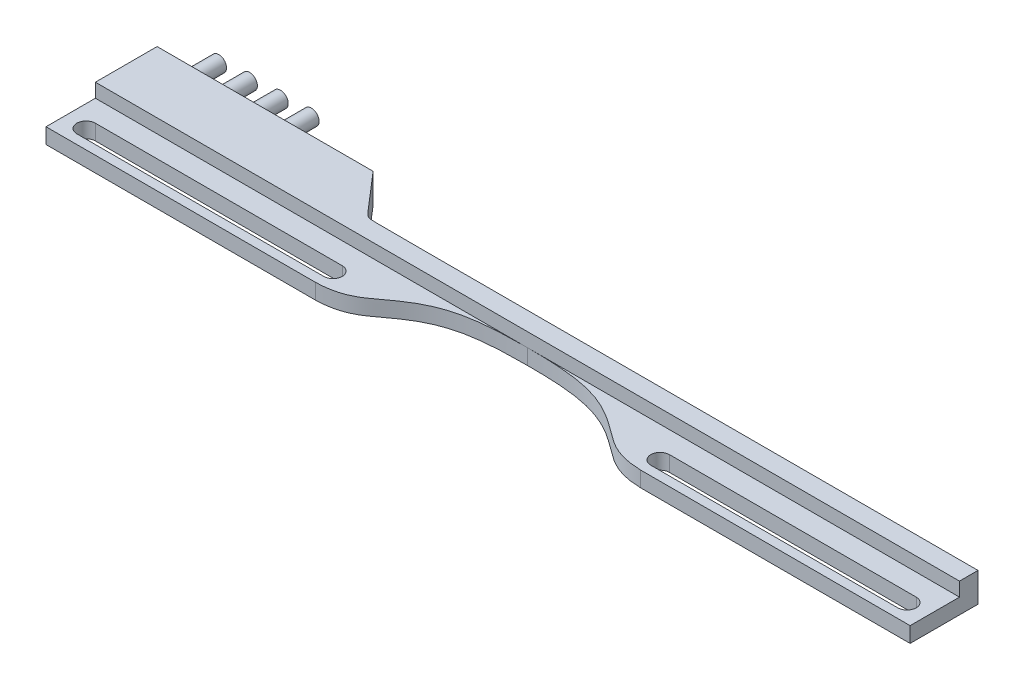
from build123d import *

# Parameters (mm, degrees)
ESBO_O1_W                = 15
ESBO_O1_H                = 4.75
RESSALTO_EXTRUS_O1_DEPTH = 140
ESBO_O3_W                = 105
ESBO_O3_H                = 7
CORTE_EXTRUS_O1_DEPTH    = 30
SKETCH1_W                = 188.959516426
SKETCH1_H                = 16.492662785
CUT_EXTRUDE2_DEPTH       = 10
SKETCH2_W                = 140
SKETCH2_H                = 8
BOSS_EXTRUDE1_DEPTH      = 2.5
CUT_EXTRUDE4_DEPTH       = 2.5
SKETCH6_R                = 1.25
BOSS_EXTRUDE2_DEPTH      = 5
FILLET1_START            = -2.375
FILLET1_DEPTH            = 4.75
CUT_EXTRUDE6_DEPTH       = 10


with BuildPart() as part:
    # Esboço1 → Ressalto-extrusão1 (new body)
    with BuildSketch(Plane(origin=(0, 0, 0), x_dir=(0, 0, -1), z_dir=(1, 0, 0))):
        with Locations((-7.5, 0)):
            Rectangle(ESBO_O1_W, ESBO_O1_H)
    extrude(amount=RESSALTO_EXTRUS_O1_DEPTH)

    # Esboço3 → Corte-extrusão1 (cut)
    with BuildSketch(Plane(origin=(0, 2.375, 0), x_dir=(1, 0, 0), z_dir=(0, 1, 0))):
        with Locations((87.5, -8.5)):
            Rectangle(ESBO_O3_W, ESBO_O3_H)
    extrude(amount=-CORTE_EXTRUS_O1_DEPTH, mode=Mode.SUBTRACT)

    # Sketch1 → Cut-Extrude2 (cut)
    with BuildSketch(Plane(origin=(0, 2.375, 0), x_dir=(1, 0, 0), z_dir=(0, 1, 0))):
        with Locations((94.479758213, 3.246331393)):
            Rectangle(SKETCH1_W, SKETCH1_H)
    extrude(amount=-CUT_EXTRUDE2_DEPTH, mode=Mode.SUBTRACT)

    # Sketch2 → Boss-Extrude1 (add)
    with BuildSketch(Plane.XZ.offset(2.375)):
        with Locations((70, 19)):
            Rectangle(SKETCH2_W, SKETCH2_H)
    extrude(amount=-BOSS_EXTRUDE1_DEPTH)

    # Sketch5 → Cut-Extrude4 (cut)
    with BuildSketch(Plane(origin=(0, 0.125, 0), x_dir=(1, 0, 0), z_dir=(0, 1, 0))):
        with BuildLine():
            Line((3.5, -18.5), (43.5, -18.5))
            ThreePointArc((43.5, -18.5), (45, -20), (43.5, -21.5))
            Line((43.5, -21.5), (3.5, -21.5))
            ThreePointArc((3.5, -21.5), (2, -20), (3.5, -18.5))
        make_face()
        with BuildLine():
            Line((136.5, -18.5), (96.5, -18.5))
            ThreePointArc((96.5, -18.5), (95, -20), (96.5, -21.5))
            Line((96.5, -21.5), (136.5, -21.5))
            ThreePointArc((136.5, -21.5), (138, -20), (136.5, -18.5))
        make_face()
    extrude(amount=-CUT_EXTRUDE4_DEPTH, mode=Mode.SUBTRACT)

    # Sketch6 → Boss-Extrude2 (add)
    with BuildSketch(Plane(origin=(0, 0, 5), x_dir=(-1, 0, 0), z_dir=(0, 0, -1))):
        with Locations(Location((-5, 0, 0), (0, 0, 270))):
            Circle(SKETCH6_R)
        with Locations(Location((-10, 0, 0), (0, 0, 270))):
            Circle(SKETCH6_R)
        with Locations(Location((-15, 0, 0), (0, 0, 270))):
            Circle(SKETCH6_R)
        with Locations(Location((-20, 0, 0), (0, 0, 270))):
            Circle(SKETCH6_R)
    extrude(amount=BOSS_EXTRUDE2_DEPTH)

    # Fillet1: read off the stored shape, not the designer's step
    # Fillet1 outline → Fillet1 (add)
    with BuildSketch(Plane(origin=(0, 0, 0), x_dir=(1, 0, 0), z_dir=(0, 1, 0)).offset(FILLET1_START)):
        with BuildLine():
            Line((140, -15), (140, -12))
            Line((140, -12), (50.198684154, -12))
            add(Edge.make_bspline(
                [(35, -5), (40.987360424, -12), (50.198684154, -12)],
                knots=[0, 0, 0, 1, 1, 1], degree=2, weights=[1, 18.165902125, 1]))
            Line((35, -5), (0, -5))
            Line((0, -5), (0, -15))
            Line((0, -15), (140, -15))
        make_face()
    extrude(amount=FILLET1_DEPTH)

    # Sketch7 → Cut-Extrude6 (cut)
    with BuildSketch(Plane(origin=(0, 0.125, 0), x_dir=(1, 0, 0), z_dir=(0, 1, 0))):
        with BuildLine():
            Line((96.34538631, -23), (43.65461369, -23))
            add(Edge.make_bspline(
                [(43.65461369, -23), (47.439098753, -22.914801017), (50.029093998, -21.120313708), (56.766609415, -16.011533513), (61.343326446, -14.978583727), (70, -15)],
                knots=[0, 0, 0, 0, 0.239896962, 0.339896962, 1, 1, 1, 1], degree=3))
            add(Edge.make_bspline(
                [(96.34538631, -23), (92.560901247, -22.914801017), (89.970906002, -21.120313708), (83.233390585, -16.011533513), (78.656673554, -14.978583727), (70, -15)],
                knots=[0, 0, 0, 0, 0.239896962, 0.339896962, 1, 1, 1, 1], degree=3))
        make_face()
    extrude(amount=-CUT_EXTRUDE6_DEPTH, mode=Mode.SUBTRACT)


solid = part.part
